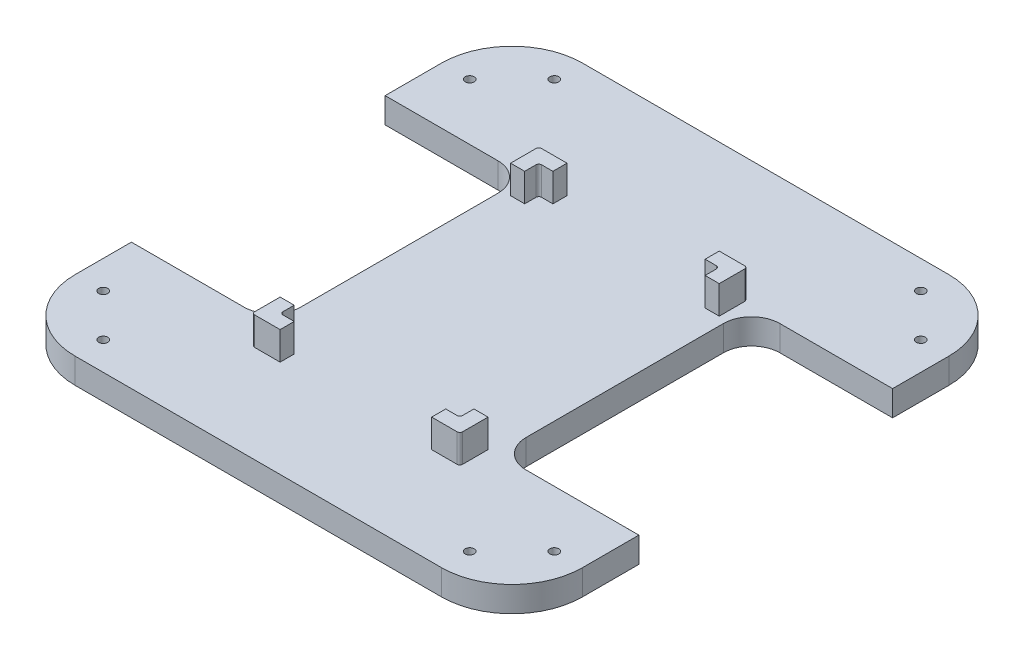
from build123d import *

# Parameters (mm, degrees)
PLATE_DEPTH               = 9
SKETCH3_R                 = 1.6
HEX_HOLES_DEPTH           = 128.597021909
RASPBERRY_PI_HOLDER_DEPTH = 10
FILLET1_R                 = 1
SKETCH5_W                 = 50
SKETCH5_H                 = 90
CUT_EXTRUDE1_DEPTH        = 128.671453348
FILLET2_R                 = 10


with BuildPart() as part:
    # Sketch1 → Plate (new body)
    with BuildSketch(Plane(origin=(0, 0, 0), x_dir=(1, 0, 0), z_dir=(0, 1, 0))):
        with BuildLine():
            Line((-65, -90), (65, -90))
            ThreePointArc((65, -90), (82.67766953, -82.67766953), (90, -65))
            Line((90, -65), (90, 65))
            ThreePointArc((90, 65), (82.67766953, 82.67766953), (65, 90))
            Line((65, 90), (-65, 90))
            ThreePointArc((-65, 90), (-82.67766953, 82.67766953), (-90, 65))
            Line((-90, 65), (-90, -65))
            ThreePointArc((-90, -65), (-82.67766953, -82.67766953), (-65, -90))
        make_face()
    extrude(amount=PLATE_DEPTH)

    # Sketch3 → Hex Holes (cut, through all)
    with BuildSketch(Plane(origin=(0, 9, 0), x_dir=(1, 0, 0), z_dir=(0, 1, 0))):
        with Locations((-65, 80)):
            Circle(SKETCH3_R)
        with Locations((-80, 65)):
            Circle(SKETCH3_R)
        with Locations((80, 65)):
            Circle(SKETCH3_R)
        with Locations((80, -65)):
            Circle(SKETCH3_R)
        with Locations((65, 80)):
            Circle(SKETCH3_R)
        with Locations((65, -80)):
            Circle(SKETCH3_R)
        with Locations((-65, -80)):
            Circle(SKETCH3_R)
        with Locations((-80, -65)):
            Circle(SKETCH3_R)
    extrude(amount=-HEX_HOLES_DEPTH, mode=Mode.SUBTRACT)

    # Sketch4 → Raspberry Pi Holder (add)
    with BuildSketch(Plane(origin=(0, 9, 0), x_dir=(1, 0, 0), z_dir=(0, 1, 0))):
        Polygon((-32, 36.5), (-32, 41.5), (-27, 41.5), (-27, 46.5), (-37, 46.5), (-37, 36.5), align=None)
        Polygon((27, 46.5), (37, 46.5), (37, 36.5), (32, 36.5), (32, 41.5), (27, 41.5), align=None)
        Polygon((-36.75, -45.5), (-36.75, -55.5), (-26.75, -55.5), (-26.75, -50.5), (-31.75, -50.5), (-31.75, -45.5), align=None)
        Polygon((27, -50.5), (27, -55.5), (37, -55.5), (37, -45.5), (32, -45.5), (32, -50.5), align=None)
    extrude(amount=RASPBERRY_PI_HOLDER_DEPTH)

    # Fillet1
    fillet1_edges = [part.edges().sort_by_distance(p)[0] for p in [
        (-37, 14, -46.5),
        (-32, 14, -41.5),
        (-31.75, 14, 50.5),
        (-36.75, 14, 55.5),
        (32, 14, 50.5),
        (37, 14, 55.5),
        (37, 14, -46.5),
        (32, 14, -41.5),
    ]]
    fillet(fillet1_edges, radius=FILLET1_R)

    # Sketch5 → Cut-Extrude1 (cut, through all)
    with BuildSketch(Plane(origin=(0, 9, 0), x_dir=(1, 0, 0), z_dir=(0, 1, 0))):
        with Locations((-65, 0)):
            Rectangle(SKETCH5_W, SKETCH5_H)
        with Locations((65, 0)):
            Rectangle(SKETCH5_W, SKETCH5_H)
    extrude(amount=-CUT_EXTRUDE1_DEPTH, mode=Mode.SUBTRACT)

    # Fillet2
    fillet2_edges = [part.edges().sort_by_distance(p)[0] for p in [
        (-40, 4.5, 45),
        (40, 4.5, 45),
        (40, 4.5, -45),
        (-40, 4.5, -45),
    ]]
    fillet(fillet2_edges, radius=FILLET2_R)


solid = part.part
